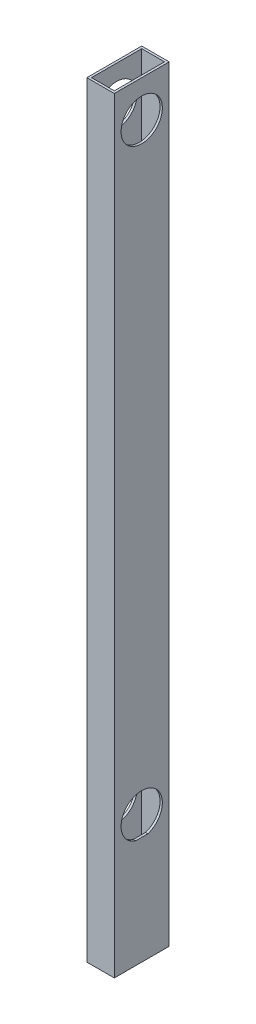
from build123d import *

# Parameters (mm, degrees)
SKETCH1_W               = 19.05
SKETCH1_H               = 38.1
SKETCH1_W_2             = 15.875
SKETCH1_H_2             = 34.925
EXTRUDE_THIN1_DEPTH     = 457.2
CUT_EXTRUDE1_DEPTH      = 460.180087221
CUT_EXTRUDE1_DEPTH_BACK = 460.180087221
SKETCH2_R               = 14.351
SKETCH3_W               = 19.05
SKETCH3_H               = 38.1
SKETCH3_W_2             = 15.875
SKETCH3_H_2             = 34.925
EXTRUDE_THIN2_DEPTH     = 75.184


with BuildPart() as part:
    # Sketch1 → Extrude-Thin1 (new body)
    with BuildSketch(Plane(origin=(0, 0, 0), x_dir=(1, 0, 0), z_dir=(0, 1, 0))):
        with Locations((9.525, 19.05)):
            Rectangle(SKETCH1_W, SKETCH1_H)
        with Locations((9.525, 19.05)):
            Rectangle(SKETCH1_W_2, SKETCH1_H_2, mode=Mode.SUBTRACT)
    extrude(amount=EXTRUDE_THIN1_DEPTH)

    # Sketch2 → Cut-Extrude1 (cut, two sides: drawn at the far end of the back side and taken through both)
    with BuildSketch(Plane(origin=(19.05, 0, 0), x_dir=(0, 0, -1), z_dir=(1, 0, 0)).offset(-CUT_EXTRUDE1_DEPTH_BACK)):
        with Locations((19.05, 13.716)):
            Circle(SKETCH2_R)
        with Locations((19.05, 431.8)):
            Circle(SKETCH2_R)
    extrude(amount=CUT_EXTRUDE1_DEPTH + CUT_EXTRUDE1_DEPTH_BACK, mode=Mode.SUBTRACT)

    # Sketch3 → Extrude-Thin2 (add)
    with BuildSketch(Plane(origin=(0, 0, 0), x_dir=(-1, 0, 0), z_dir=(0, -1, 0))):
        with Locations((-9.525, 19.05)):
            Rectangle(SKETCH3_W, SKETCH3_H)
        with Locations((-9.525, 19.05)):
            Rectangle(SKETCH3_W_2, SKETCH3_H_2, mode=Mode.SUBTRACT)
    extrude(amount=EXTRUDE_THIN2_DEPTH)


solid = part.part
